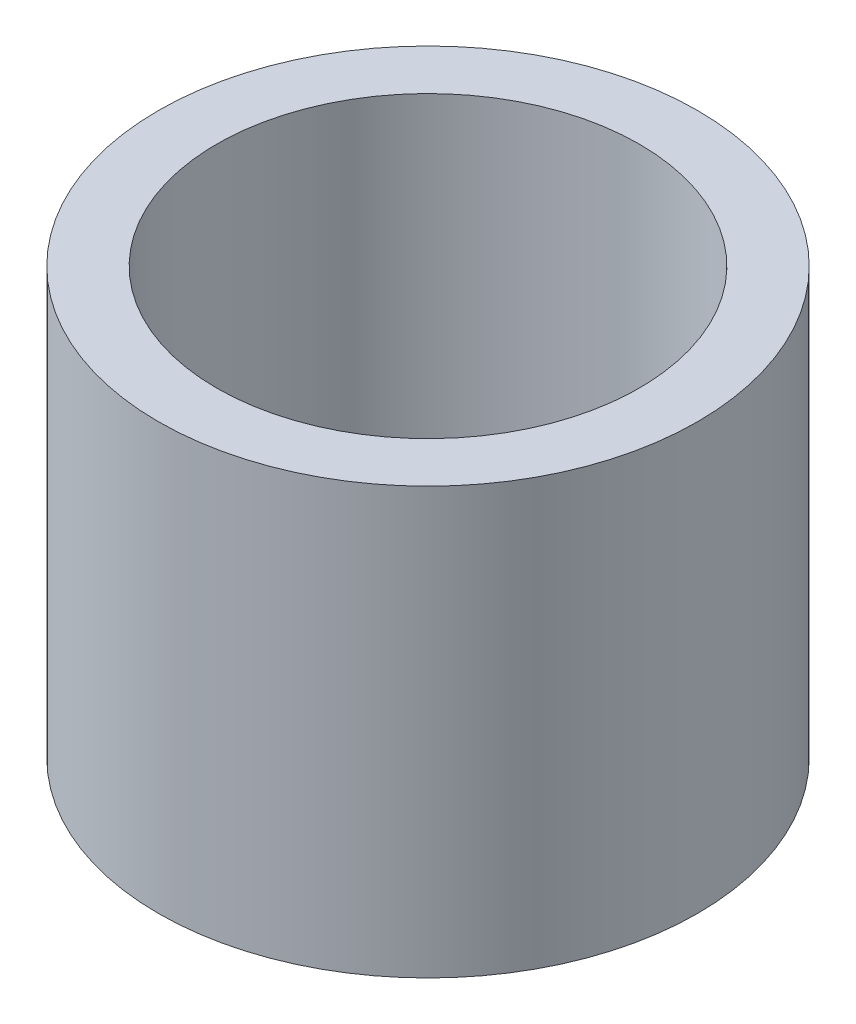
from build123d import *

# Parameters (mm, degrees)
SKETCH1_R           = 3.175
SKETCH1_R_2         = 2.4892
BOSS_EXTRUDE1_DEPTH = 5.0165


with BuildPart() as part:
    # Sketch1 → Boss-Extrude1 (new body)
    with BuildSketch(Plane(origin=(0, 0, 0), x_dir=(1, 0, 0), z_dir=(0, 1, 0))):
        Circle(SKETCH1_R)
        Circle(SKETCH1_R_2, mode=Mode.SUBTRACT)
    extrude(amount=BOSS_EXTRUDE1_DEPTH)


solid = part.part
